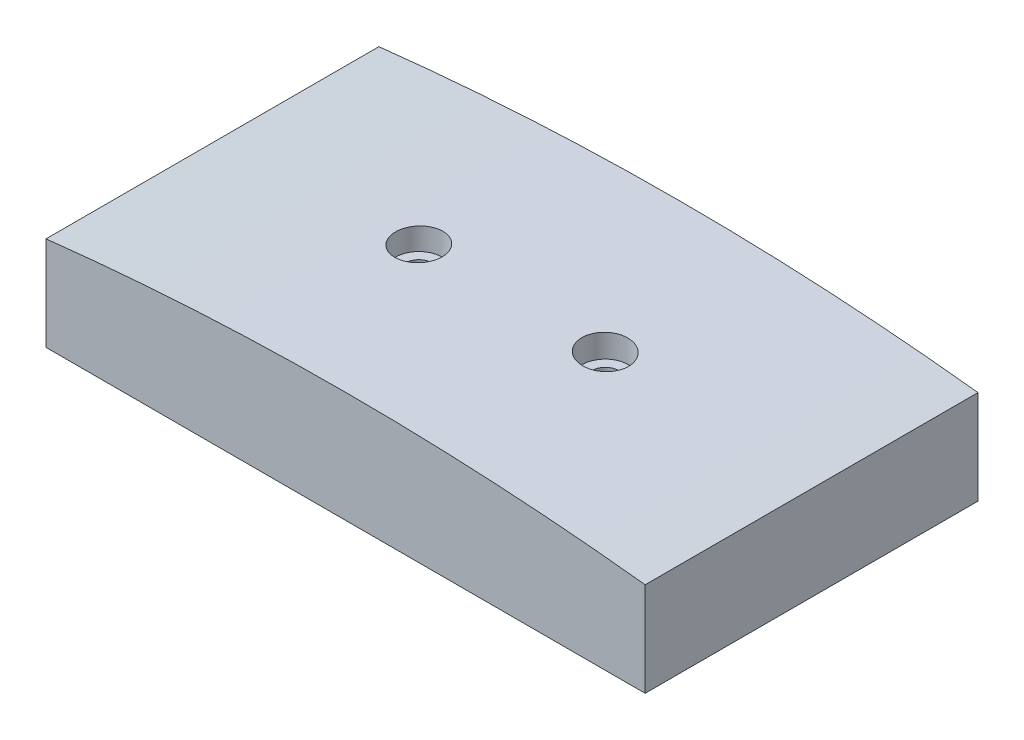
from build123d import *

# Parameters (mm, degrees)
BOSS_EXTRUDE1_DEPTH = 25
CUT_EXTRUDE2_START  = -18
SKETCH2_R           = 3.5
CUT_EXTRUDE2_DEPTH  = 5
SKETCH4_R           = 2
CUT_EXTRUDE3_DEPTH  = 54.094255942


with BuildPart() as part:
    # Sketch1 → Boss-Extrude1 (new, symmetric)
    with BuildSketch(Plane.XY):
        with BuildLine():
            Line((-45, 14.122450494), (-45, 0))
            Line((-45, 0), (45, 0))
            Line((45, 0), (45, 14.122450494))
            ThreePointArc((45, 14.122450494), (0, 16.661760613), (-45, 14.122450494))
        make_face()
    extrude(amount=BOSS_EXTRUDE1_DEPTH, both=True)

    # Sketch2 → Cut-Extrude2 (cut)
    with BuildSketch(Plane.XZ.offset(CUT_EXTRUDE2_START)):
        with Locations((-14, 0)):
            Circle(SKETCH2_R)
        with Locations((14, 0)):
            Circle(SKETCH2_R)
    extrude(amount=CUT_EXTRUDE2_DEPTH, mode=Mode.SUBTRACT)

    # Sketch4 → Cut-Extrude3 (cut, through all)
    with BuildSketch(Plane(origin=(0, 13, 0), x_dir=(1, 0, 0), z_dir=(0, 1, 0))):
        with Locations((-14, 0)):
            Circle(SKETCH4_R)
    cut_extrude3 = extrude(amount=-CUT_EXTRUDE3_DEPTH, mode=Mode.SUBTRACT)

    # Mirror2: Cut-Extrude3 across plane
    add(cut_extrude3.mirror(Plane(origin=(0, 0, 0), x_dir=(0, 0, 1), z_dir=(1, 0, 0))), mode=Mode.SUBTRACT)


solid = part.part
